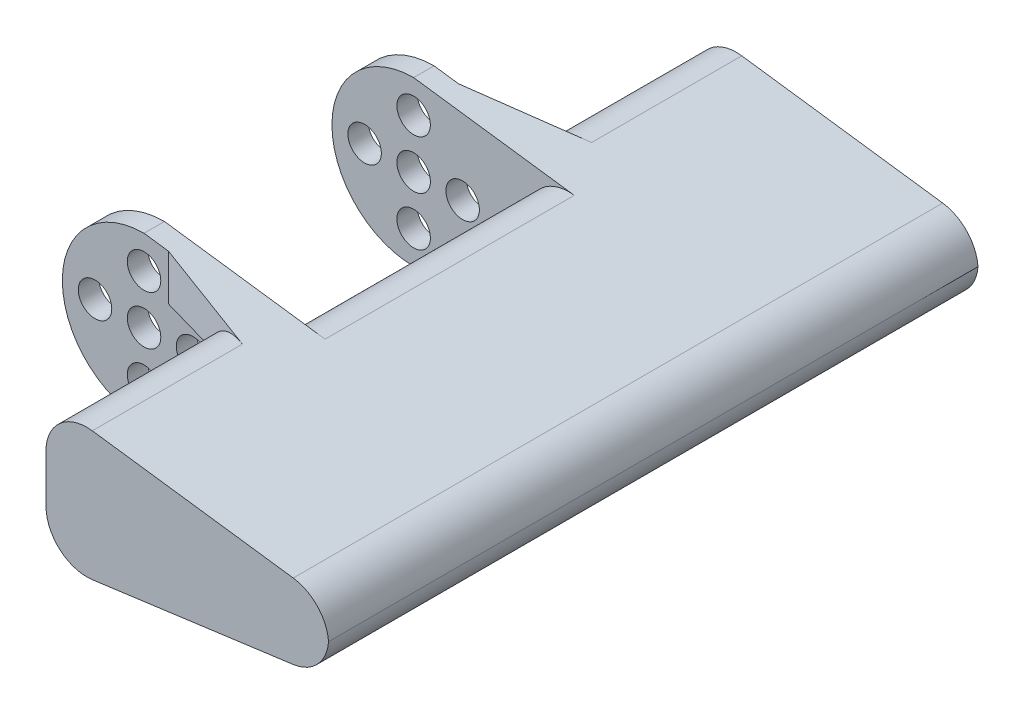
from build123d import *

# Parameters (mm, degrees)
BOSS_EXTRU_1_DEPTH           = 2.5
ESQUISSE2_R                  = 2.05
ENL_V_MAT_EXTRU_1_DEPTH      = 49.94129136
BOSS_EXTRU_2_DEPTH           = 33
ESQUISSE6_R                  = 2.05
BOSS_EXTRU_3_DEPTH           = 2.5
BOSS_EXTRU_4_DEPTH           = 2
BOSS_EXTRU_5_START           = -35.5
BOSS_EXTRU_5_DEPTH           = 2
ENL_V_MAT_EXTRU_5_DEPTH      = 62.605600395
ENL_V_MAT_EXTRU_5_DEPTH_BACK = 62.605600395
BOSS_EXTRU_6_DEPTH           = 20
BOSS_EXTRU_7_START           = -39.5
BOSS_EXTRU_7_DEPTH           = 20
CONG_1_R                     = 5


with BuildPart() as part:
    # Esquisse1 → Boss.-Extru.1 (new body)
    with BuildSketch(Plane.XY):
        with BuildLine():
            Line((0, 0), (44.598206242, 6))
            Line((44.598206242, 6), (44.598206242, 14))
            Line((44.598206242, 14), (0, 20))
            ThreePointArc((0, 20), (-10, 10), (0, 0))
        make_face()
    extrude(amount=BOSS_EXTRU_1_DEPTH)

    # Esquisse2 → Enlèv. mat.-Extru.1 (cut, through all)
    with BuildSketch(Plane.XY.offset(2.5)):
        with Locations((-6, 10)):
            Circle(ESQUISSE2_R)
        with Locations((0, 4)):
            Circle(ESQUISSE2_R)
        with Locations(Location((0, 16, 0), (0, 0, 180))):
            Circle(ESQUISSE2_R)
        with Locations(Location((6, 10, 0), (0, 0, 180))):
            Circle(ESQUISSE2_R)
        with Locations((0, 10)):
            Circle(ESQUISSE2_R)
    extrude(amount=-ENL_V_MAT_EXTRU_1_DEPTH, mode=Mode.SUBTRACT)

    # Esquisse5 → Boss.-Extru.2 (add)
    with BuildSketch(Plane.XY.offset(2.5)):
        Polygon((44.598206242, 14), (14, 18.116516177), (14, 1.883483823), (44.598206242, 6), align=None)
    extrude(amount=BOSS_EXTRU_2_DEPTH)

    # Esquisse6 → Boss.-Extru.3 (add)
    with BuildSketch(Plane.XY.offset(35.5)):
        with BuildLine():
            Line((44.598206242, 14), (0, 20))
            ThreePointArc((0, 20), (-10, 10), (0, 0))
            Line((0, 0), (44.598206242, 6))
            Line((44.598206242, 6), (44.598206242, 14))
        make_face()
        with Locations(Location((0, 16, 0), (0, 0, 180))):
            Circle(ESQUISSE6_R, mode=Mode.SUBTRACT)
        with Locations((-6, 10)):
            Circle(ESQUISSE6_R, mode=Mode.SUBTRACT)
        with Locations(Location((6, 10, 0), (0, 0, 180))):
            Circle(ESQUISSE6_R, mode=Mode.SUBTRACT)
        with Locations((0, 4)):
            Circle(ESQUISSE6_R, mode=Mode.SUBTRACT)
        with Locations((0, 10)):
            Circle(ESQUISSE6_R, mode=Mode.SUBTRACT)
    extrude(amount=-BOSS_EXTRU_3_DEPTH)

    # Esquisse9 → Boss.-Extru.4 (add)
    with BuildSketch(Plane.XY.offset(35.5)):
        Polygon((44.598206242, 14), (3, 19.596396324), (3, 14), (10, 14), (10, 6), (3, 6), (3, 0.403603676), (44.598206242, 6), align=None)
    extrude(amount=BOSS_EXTRU_4_DEPTH)

    # Esquisse9<2> → Boss.-Extru.5 (add)
    with BuildSketch(Plane.XY.offset(35.5).offset(BOSS_EXTRU_5_START)):
        Polygon((44.598206242, 14), (3, 19.596396324), (3, 14), (10, 14), (10, 6), (3, 6), (3, 0.403603676), (44.598206242, 6), align=None)
    extrude(amount=-BOSS_EXTRU_5_DEPTH)

    # Esquisse11 → Enlèv. mat.-Extru.5 (cut, two sides: drawn at the far end of the back side and taken through both)
    with BuildSketch(Plane(origin=(0, 0, 0), x_dir=(1, 0, 0), z_dir=(0, 1, 0)).offset(-ENL_V_MAT_EXTRU_5_DEPTH_BACK)):
        Polygon((3, -35.5), (10, -37.5), (3, -37.5), align=None)
        Polygon((3, 2), (3, 0), (10, 2), align=None)
    extrude(amount=ENL_V_MAT_EXTRU_5_DEPTH + ENL_V_MAT_EXTRU_5_DEPTH_BACK, mode=Mode.SUBTRACT)

    # Esquisse12 → Boss.-Extru.6 (add)
    with BuildSketch(Plane(origin=(0, 0, -2), x_dir=(-1, 0, 0), z_dir=(0, 0, -1))):
        Polygon((-44.598206242, 14), (-44.598206242, 6), (-10, 1.345345588), (-10, 18.654654412), align=None)
    extrude(amount=BOSS_EXTRU_6_DEPTH)

    # Esquisse12<2> → Boss.-Extru.7 (add)
    with BuildSketch(Plane(origin=(0, 0, -2), x_dir=(-1, 0, 0), z_dir=(0, 0, -1)).offset(BOSS_EXTRU_7_START)):
        Polygon((-44.598206242, 14), (-44.598206242, 6), (-10, 1.345345588), (-10, 18.654654412), align=None)
    extrude(amount=-BOSS_EXTRU_7_DEPTH)

    # Congé1
    # the kernel refuses this fillet: 5 mm, written as the material it takes off along each edge
    with BuildSketch(Plane(origin=(10, 18.654654412, 23.205703128), x_dir=(0.9910712498212338, -0.1333333333333327, 0), z_dir=(0, 0, 1))) as cong_1_piece_1_section:
        with BuildLine():
            CenterArc((CONG_1_R * 1.14354374979, -CONG_1_R), CONG_1_R, 90, 97.662255661)
            Line((CONG_1_R * 0.152472499972, -CONG_1_R * 1.13333333333), (0, 0))
            Line((0, 0), (CONG_1_R * 1.14354374979, 0))
        make_face()
    cong_1_piece_1 = extrude(amount=48.588593745, mode=Mode.PRIVATE)
    cong_1_piece_1 = split(cong_1_piece_1, bisect_by=Plane(origin=(14.41713272, 17.97630815, 33), z_dir=(0, 0, -1)), keep=Keep.TOP, mode=Mode.PRIVATE)
    add(cong_1_piece_1, mode=Mode.SUBTRACT)
    with BuildSketch(Plane(origin=(10, 18.654654412, 23.205703128), x_dir=(0.9910712498212338, -0.1333333333333327, 0), z_dir=(0, 0, 1))) as cong_1_piece_2_section:
        with BuildLine():
            CenterArc((CONG_1_R * 1.14354374979, -CONG_1_R), CONG_1_R, 90, 97.662255661)
            Line((CONG_1_R * 0.152472499972, -CONG_1_R * 1.13333333333), (0, 0))
            Line((0, 0), (CONG_1_R * 1.14354374979, 0))
        make_face()
    cong_1_piece_2 = extrude(amount=48.588593745, mode=Mode.PRIVATE)
    cong_1_piece_2 = split(cong_1_piece_2, bisect_by=Plane(origin=(16.890425436, 17.976343962, 39.468692982), z_dir=(-0.27472112789737807, 0, 0.9615239476408232)), keep=Keep.TOP, mode=Mode.PRIVATE)
    add(cong_1_piece_2, mode=Mode.SUBTRACT)
    with BuildSketch(Plane(origin=(10, 18.654654412, 23.205703128), x_dir=(0.9910712498212338, -0.1333333333333327, 0), z_dir=(0, 0, 1))) as cong_1_piece_3_section:
        with BuildLine():
            CenterArc((CONG_1_R * 1.14354374979, -CONG_1_R), CONG_1_R, 90, 97.662255661)
            Line((CONG_1_R * 0.152472499972, -CONG_1_R * 1.13333333333), (0, 0))
            Line((0, 0), (CONG_1_R * 1.14354374979, 0))
        make_face()
    cong_1_piece_3 = extrude(amount=48.588593745, mode=Mode.PRIVATE)
    cong_1_piece_3 = split(cong_1_piece_3, bisect_by=Plane(origin=(10.034324998, 14, 36.504903571), z_dir=(0, -1, 0)), keep=Keep.TOP, mode=Mode.PRIVATE)
    cong_1_piece_3 = split(cong_1_piece_3, bisect_by=Plane(origin=(10.034324998, 13.735276956, 35.5), z_dir=(0, 0, 1)), keep=Keep.TOP, mode=Mode.PRIVATE)
    add(cong_1_piece_3, mode=Mode.SUBTRACT)
    with BuildSketch(Plane(origin=(10, 1.345345588, 23.205703128), x_dir=(0.9910712498212336, 0.13333333333333347, 0), z_dir=(0, 0, 1))) as cong_1_piece_4_section:
        with BuildLine():
            CenterArc((CONG_1_R * 1.14354374979, CONG_1_R), CONG_1_R, 172.337744339, 97.662255661)
            Line((CONG_1_R * 0.152472499972, CONG_1_R * 1.13333333333), (0, 0))
            Line((0, 0), (CONG_1_R * 1.14354374979, 0))
        make_face()
    cong_1_piece_4 = extrude(amount=48.588593745, mode=Mode.PRIVATE)
    cong_1_piece_4 = split(cong_1_piece_4, bisect_by=Plane(origin=(14.41713272, 2.02369185, 33), z_dir=(0, 0, -1)), keep=Keep.TOP, mode=Mode.PRIVATE)
    add(cong_1_piece_4, mode=Mode.SUBTRACT)
    with BuildSketch(Plane(origin=(10, 1.345345588, 23.205703128), x_dir=(0.9910712498212336, 0.13333333333333347, 0), z_dir=(0, 0, 1))) as cong_1_piece_5_section:
        with BuildLine():
            CenterArc((CONG_1_R * 1.14354374979, CONG_1_R), CONG_1_R, 172.337744339, 97.662255661)
            Line((CONG_1_R * 0.152472499972, CONG_1_R * 1.13333333333), (0, 0))
            Line((0, 0), (CONG_1_R * 1.14354374979, 0))
        make_face()
    cong_1_piece_5 = extrude(amount=48.588593745, mode=Mode.PRIVATE)
    cong_1_piece_5 = split(cong_1_piece_5, bisect_by=Plane(origin=(16.890425436, 2.023656038, 39.468692982), z_dir=(-0.27472112789737807, 0, 0.9615239476408232)), keep=Keep.TOP, mode=Mode.PRIVATE)
    add(cong_1_piece_5, mode=Mode.SUBTRACT)
    with BuildSketch(Plane(origin=(10, 1.345345588, 23.205703128), x_dir=(0.9910712498212336, 0.13333333333333347, 0), z_dir=(0, 0, 1))) as cong_1_piece_6_section:
        with BuildLine():
            CenterArc((CONG_1_R * 1.14354374979, CONG_1_R), CONG_1_R, 172.337744339, 97.662255661)
            Line((CONG_1_R * 0.152472499972, CONG_1_R * 1.13333333333), (0, 0))
            Line((0, 0), (CONG_1_R * 1.14354374979, 0))
        make_face()
    cong_1_piece_6 = extrude(amount=48.588593745, mode=Mode.PRIVATE)
    cong_1_piece_6 = split(cong_1_piece_6, bisect_by=Plane(origin=(10.034324998, 6, 36.504903571), z_dir=(0, 1, 0)), keep=Keep.TOP, mode=Mode.PRIVATE)
    cong_1_piece_6 = split(cong_1_piece_6, bisect_by=Plane(origin=(10.034324998, 6.264723044, 35.5), z_dir=(0, 0, 1)), keep=Keep.TOP, mode=Mode.PRIVATE)
    add(cong_1_piece_6, mode=Mode.SUBTRACT)
    with BuildSketch(Plane(origin=(10, 18.654654412, 12.294296872), x_dir=(0, -1, 0), z_dir=(0, 0, -1))) as cong_1_piece_7_section:
        with BuildLine():
            CenterArc((CONG_1_R * 1.14354374979, -CONG_1_R), CONG_1_R, 90, 97.662255661)
            Line((CONG_1_R * 0.152472499972, -CONG_1_R * 1.13333333333), (0, 0))
            Line((0, 0), (CONG_1_R * 1.14354374979, 0))
        make_face()
    cong_1_piece_7 = extrude(amount=48.588593745, mode=Mode.PRIVATE)
    cong_1_piece_7 = split(cong_1_piece_7, bisect_by=Plane(origin=(14.41713272, 17.97630815, 2.5), z_dir=(0, 0, 1)), keep=Keep.TOP, mode=Mode.PRIVATE)
    add(cong_1_piece_7, mode=Mode.SUBTRACT)
    with BuildSketch(Plane(origin=(10, 18.654654412, 12.294296872), x_dir=(0, -1, 0), z_dir=(0, 0, -1))) as cong_1_piece_8_section:
        with BuildLine():
            CenterArc((CONG_1_R * 1.14354374979, -CONG_1_R), CONG_1_R, 90, 97.662255661)
            Line((CONG_1_R * 0.152472499972, -CONG_1_R * 1.13333333333), (0, 0))
            Line((0, 0), (CONG_1_R * 1.14354374979, 0))
        make_face()
    cong_1_piece_8 = extrude(amount=48.588593745, mode=Mode.PRIVATE)
    cong_1_piece_8 = split(cong_1_piece_8, bisect_by=Plane(origin=(10.034324998, 14, -1.004903571), z_dir=(0, -1, 0)), keep=Keep.TOP, mode=Mode.PRIVATE)
    cong_1_piece_8 = split(cong_1_piece_8, bisect_by=Plane(origin=(10.034324998, 13.735276956, 0), z_dir=(0, 0, -1)), keep=Keep.TOP, mode=Mode.PRIVATE)
    add(cong_1_piece_8, mode=Mode.SUBTRACT)
    with BuildSketch(Plane(origin=(10, 18.654654412, 12.294296872), x_dir=(0, -1, 0), z_dir=(0, 0, -1))) as cong_1_piece_9_section:
        with BuildLine():
            CenterArc((CONG_1_R * 1.14354374979, -CONG_1_R), CONG_1_R, 90, 97.662255661)
            Line((CONG_1_R * 0.152472499972, -CONG_1_R * 1.13333333333), (0, 0))
            Line((0, 0), (CONG_1_R * 1.14354374979, 0))
        make_face()
    cong_1_piece_9 = extrude(amount=48.588593745, mode=Mode.PRIVATE)
    cong_1_piece_9 = split(cong_1_piece_9, bisect_by=Plane(origin=(13.812288086, 17.172261855, -3.089225167), z_dir=(-0.27472112789737835, 0, -0.9615239476408232)), keep=Keep.TOP, mode=Mode.PRIVATE)
    add(cong_1_piece_9, mode=Mode.SUBTRACT)
    with BuildSketch(Plane(origin=(10, 1.345345588, 12.294296872), x_dir=(0.9910712498212336, 0.13333333333333347, 0), z_dir=(0, 0, -1))) as cong_1_piece_10_section:
        with BuildLine():
            CenterArc((CONG_1_R * 1.14354374979, -CONG_1_R), CONG_1_R, 90, 97.662255661)
            Line((CONG_1_R * 0.152472499972, -CONG_1_R * 1.13333333333), (0, 0))
            Line((0, 0), (CONG_1_R * 1.14354374979, 0))
        make_face()
    cong_1_piece_10 = extrude(amount=48.588593745, mode=Mode.PRIVATE)
    cong_1_piece_10 = split(cong_1_piece_10, bisect_by=Plane(origin=(14.41713272, 2.02369185, 2.5), z_dir=(0, 0, 1)), keep=Keep.TOP, mode=Mode.PRIVATE)
    add(cong_1_piece_10, mode=Mode.SUBTRACT)
    with BuildSketch(Plane(origin=(10, 1.345345588, 12.294296872), x_dir=(0.9910712498212336, 0.13333333333333347, 0), z_dir=(0, 0, -1))) as cong_1_piece_11_section:
        with BuildLine():
            CenterArc((CONG_1_R * 1.14354374979, -CONG_1_R), CONG_1_R, 90, 97.662255661)
            Line((CONG_1_R * 0.152472499972, -CONG_1_R * 1.13333333333), (0, 0))
            Line((0, 0), (CONG_1_R * 1.14354374979, 0))
        make_face()
    cong_1_piece_11 = extrude(amount=48.588593745, mode=Mode.PRIVATE)
    cong_1_piece_11 = split(cong_1_piece_11, bisect_by=Plane(origin=(16.890425436, 2.023656038, -3.968692982), z_dir=(-0.27472112789737835, 0, -0.9615239476408232)), keep=Keep.TOP, mode=Mode.PRIVATE)
    add(cong_1_piece_11, mode=Mode.SUBTRACT)
    with BuildSketch(Plane(origin=(10, 1.345345588, 12.294296872), x_dir=(0.9910712498212336, 0.13333333333333347, 0), z_dir=(0, 0, -1))) as cong_1_piece_12_section:
        with BuildLine():
            CenterArc((CONG_1_R * 1.14354374979, -CONG_1_R), CONG_1_R, 90, 97.662255661)
            Line((CONG_1_R * 0.152472499972, -CONG_1_R * 1.13333333333), (0, 0))
            Line((0, 0), (CONG_1_R * 1.14354374979, 0))
        make_face()
    cong_1_piece_12 = extrude(amount=48.588593745, mode=Mode.PRIVATE)
    cong_1_piece_12 = split(cong_1_piece_12, bisect_by=Plane(origin=(10.034324998, 6, -1.004903571), z_dir=(0, 1, 0)), keep=Keep.TOP, mode=Mode.PRIVATE)
    cong_1_piece_12 = split(cong_1_piece_12, bisect_by=Plane(origin=(10.034324998, 6.264723044, 0), z_dir=(0, 0, -1)), keep=Keep.TOP, mode=Mode.PRIVATE)
    add(cong_1_piece_12, mode=Mode.SUBTRACT)
    with BuildSketch(Plane(origin=(14, 18.116516177, 2.5), x_dir=(0.9910712498212336, -0.13333333333333325, 0), z_dir=(0, 0, 1))) as cong_1_piece_13:
        with BuildLine():
            CenterArc((CONG_1_R * 1.14354374979, -CONG_1_R), CONG_1_R, 90, 97.662255661)
            Line((CONG_1_R * 0.152472499972, -CONG_1_R * 1.13333333333), (0, 0))
            Line((0, 0), (CONG_1_R * 1.14354374979, 0))
        make_face()
    extrude(amount=30.5, mode=Mode.SUBTRACT)
    with BuildSketch(Plane(origin=(14, 1.883483823, 2.5), x_dir=(0.9910712498212336, 0.13333333333333353, 0), z_dir=(0, 0, 1))) as cong_1_piece_14:
        with BuildLine():
            CenterArc((CONG_1_R * 1.14354374979, CONG_1_R), CONG_1_R, 172.337744339, 97.662255661)
            Line((CONG_1_R * 0.152472499972, CONG_1_R * 1.13333333333), (0, 0))
            Line((0, 0), (CONG_1_R * 1.14354374979, 0))
        make_face()
    extrude(amount=30.5, mode=Mode.SUBTRACT)
    with BuildSketch(Plane(origin=(44.598206242, 14, -32.930932902), x_dir=(-0.9910712498212338, 0.13333333333333305, 0), z_dir=(0, 0, 1))) as cong_1_piece_15:
        with BuildLine():
            CenterArc((CONG_1_R * 0.874474632195, CONG_1_R), CONG_1_R, 187.662255661, 82.337744339)
            Line((-CONG_1_R * 0.116596617626, CONG_1_R * 0.866666666667), (0, 0))
            Line((0, 0), (CONG_1_R * 0.874474632195, 0))
        make_face()
    extrude(amount=101.361865805, mode=Mode.SUBTRACT)
    with BuildSketch(Plane(origin=(44.598206242, 6, -32.930932902), x_dir=(-0.9910712498212337, -0.1333333333333333, 0), z_dir=(0, 0, 1))) as cong_1_piece_16:
        with BuildLine():
            CenterArc((CONG_1_R * 0.874474632195, -CONG_1_R), CONG_1_R, 90, 82.337744339)
            Line((-CONG_1_R * 0.116596617626, -CONG_1_R * 0.866666666667), (0, 0))
            Line((0, 0), (CONG_1_R * 0.874474632195, 0))
        make_face()
    extrude(amount=101.361865805, mode=Mode.SUBTRACT)


solid = part.part
